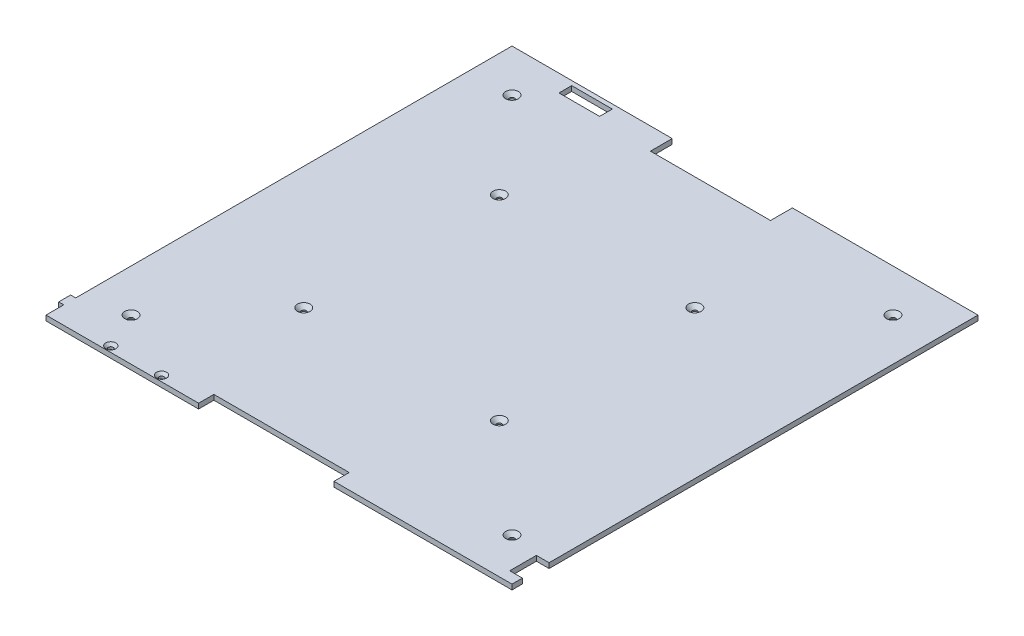
from build123d import *

# Parameters (mm, degrees)
BOSS_EXTRUDE1_DEPTH = 2
SKETCH2_R           = 1
CUT_EXTRUDE1_DEPTH  = 132.191177295
CHAMFER1_SIZE       = 1.5
SKETCH3_W           = 16
SKETCH3_H           = 5
CUT_EXTRUDE2_DEPTH  = 132.191177295
SKETCH4_W           = 7.628930623
SKETCH4_H           = 40
CUT_EXTRUDE3_DEPTH  = 1.4
SKETCH5_R           = 1
CUT_EXTRUDE4_DEPTH  = 132.191177295
CHAMFER2_SIZE       = 1


with BuildPart() as part:
    # Sketch1 → Boss-Extrude1 (new body)
    with BuildSketch(Plane(origin=(0, 0, 0), x_dir=(1, 0, 0), z_dir=(0, 1, 0))):
        Polygon((-91.75, 91.75), (-91.75, -80.05), (-93.75, -80.05), (-93.75, -84.75), (-91.75, -84.75), (-91.75, -91.75), (-31.65, -91.75), (-31.65, -85.75), (21.65, -85.75), (21.65, -91.75), (91.75, -91.75), (91.75, -87.65), (86.75, -87.65), (86.75, -77.15), (91.75, -77.15), (91.75, 91.75), (18.65, 91.75), (18.65, 83.15), (-28.65, 83.15), (-28.65, 91.75), align=None)
    extrude(amount=BOSS_EXTRUDE1_DEPTH)

    # Sketch2 → Cut-Extrude1 (cut, through all)
    with BuildSketch(Plane.XZ):
        with Locations((75, -75)):
            Circle(SKETCH2_R)
        with Locations((-75, -75)):
            Circle(SKETCH2_R)
        with Locations((-75, 75)):
            Circle(SKETCH2_R)
        with Locations((75, 75)):
            Circle(SKETCH2_R)
        with Locations((33.5, -38.5)):
            Circle(SKETCH2_R)
        with Locations((33.5, 38.5)):
            Circle(SKETCH2_R)
        with Locations((-43.5, -38.5)):
            Circle(SKETCH2_R)
        with Locations((-43.5, 38.5)):
            Circle(SKETCH2_R)
    extrude(amount=-CUT_EXTRUDE1_DEPTH, mode=Mode.SUBTRACT)

    # Chamfer1
    chamfer1_edges = [part.edges().sort_by_distance(p)[0] for p in [
        (74, 2, -75),
        (32.5, 2, -38.5),
        (74, 2, 75),
        (32.5, 2, 38.5),
        (-44.5, 2, 38.5),
        (-44.5, 2, -38.5),
        (-76, 2, -75),
        (-76, 2, 75),
    ]]
    chamfer(chamfer1_edges, length=CHAMFER1_SIZE)

    # Sketch3 → Cut-Extrude2 (cut, through all)
    with BuildSketch(Plane.XZ):
        with Locations((-58.5, -87.5)):
            Rectangle(SKETCH3_W, SKETCH3_H)
    extrude(amount=-CUT_EXTRUDE2_DEPTH, mode=Mode.SUBTRACT)

    # Sketch4 → Cut-Extrude3 (cut)
    with BuildSketch(Plane.XZ):
        with Locations((-43.615138368, 0.25)):
            Rectangle(SKETCH4_W, SKETCH4_H)
    extrude(amount=-CUT_EXTRUDE3_DEPTH, mode=Mode.SUBTRACT)

    # Sketch5 → Cut-Extrude4 (cut, through all)
    with BuildSketch(Plane.XZ):
        with Locations((-48.5, 89.5)):
            Circle(SKETCH5_R)
        with Locations((-68.5, 89.5)):
            Circle(SKETCH5_R)
    extrude(amount=-CUT_EXTRUDE4_DEPTH, mode=Mode.SUBTRACT)

    # Chamfer2
    chamfer2_edges = [part.edges().sort_by_distance(p)[0] for p in [
        (-49.5, 2, 89.5),
        (-69.5, 2, 89.5),
    ]]
    chamfer(chamfer2_edges, length=CHAMFER2_SIZE)


solid = part.part
